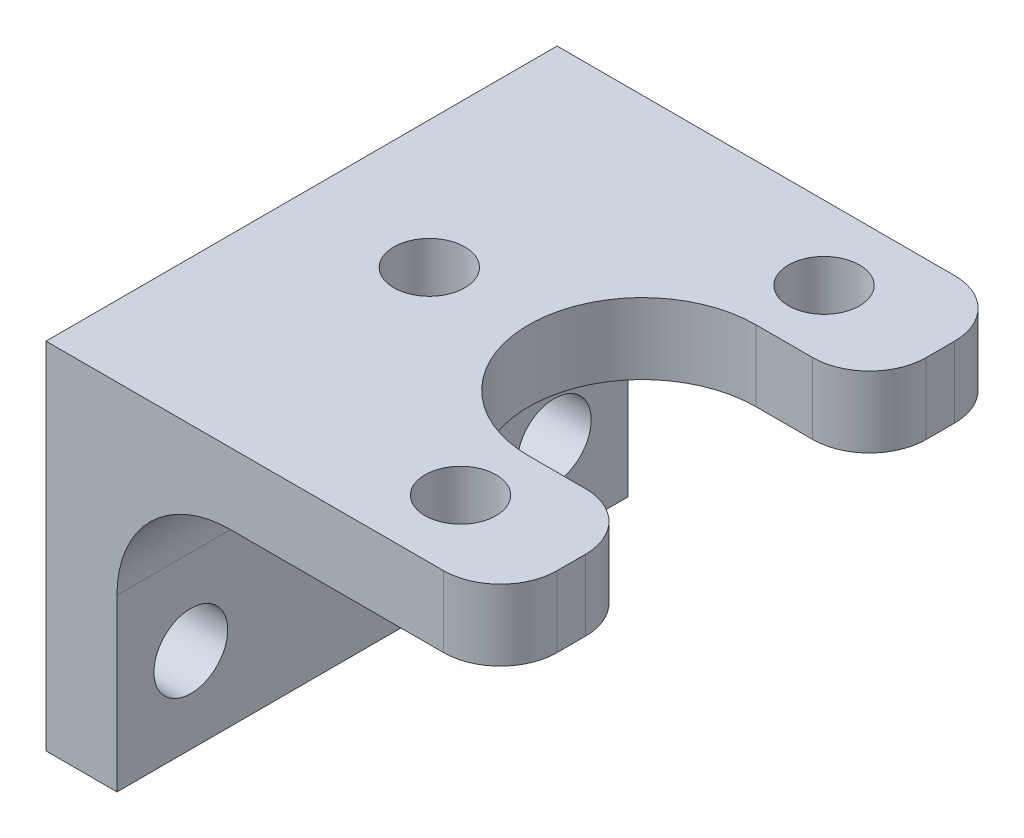
from build123d import *

# Parameters (mm, degrees)
SKETCH1_W           = 20.32
SKETCH1_H           = 22.86
BOSS_EXTRUDE1_DEPTH = 3.175
FILLET1_R           = 2.54
FILLET2_R           = 2.54
CUT_EXTRUDE2_DEPTH  = 16.618934823
FILLET3_R           = 2.54
FILLET4_R           = 2.54
SKETCH4_W           = 3.175
SKETCH4_H           = 22.86
BOSS_EXTRUDE2_DEPTH = 12.7
FILLET6_R           = 5.08
SKETCH3_R           = 1.5875
CUT_EXTRUDE3_DEPTH  = 6.35
SKETCH5_R           = 11.43
CUT_EXTRUDE4_DEPTH  = 5.08
SKETCH6_R           = 1.651
CUT_EXTRUDE5_DEPTH  = 25.205080609


with BuildPart() as part:
    # Sketch1 → Boss-Extrude1 (new body)
    with BuildSketch(Plane(origin=(0, 0, 0), x_dir=(1, 0, 0), z_dir=(0, 1, 0))):
        Rectangle(SKETCH1_W, SKETCH1_H)
    extrude(amount=BOSS_EXTRUDE1_DEPTH)

    # Fillet1
    fillet1_edges = [part.edges().sort_by_distance(p)[0] for p in [
        (10.16, 1.5875, -11.43),
    ]]
    fillet(fillet1_edges, radius=FILLET1_R)

    # Fillet2
    fillet2_edges = [part.edges().sort_by_distance(p)[0] for p in [
        (10.16, 1.5875, 11.43),
    ]]
    fillet(fillet2_edges, radius=FILLET2_R)

    # Sketch2 → Cut-Extrude2 (cut, through all)
    with BuildSketch(Plane.XZ):
        with BuildLine():
            Line((5.08, -5.08), (10.16, -5.08))
            Line((10.16, -5.08), (10.16, 5.08))
            Line((10.16, 5.08), (5.08, 5.08))
            ThreePointArc((5.08, 5.08), (0, 0), (5.08, -5.08))
        make_face()
    extrude(amount=-CUT_EXTRUDE2_DEPTH, mode=Mode.SUBTRACT)

    # Fillet3
    fillet3_edges = [part.edges().sort_by_distance(p)[0] for p in [
        (10.16, 1.5875, 5.08),
    ]]
    fillet(fillet3_edges, radius=FILLET3_R)

    # Fillet4
    fillet4_edges = [part.edges().sort_by_distance(p)[0] for p in [
        (10.16, 1.5875, -5.08),
    ]]
    fillet(fillet4_edges, radius=FILLET4_R)

    # Sketch4 → Boss-Extrude2 (add)
    with BuildSketch(Plane.XZ):
        with Locations((-8.5725, 0)):
            Rectangle(SKETCH4_W, SKETCH4_H)
    extrude(amount=BOSS_EXTRUDE2_DEPTH)

    # Fillet6
    fillet6_edges = [part.edges().sort_by_distance(p)[0] for p in [
        (-6.985, 0, 0),
    ]]
    fillet(fillet6_edges, radius=FILLET6_R)

    # Sketch3 → Cut-Extrude3 (cut, symmetric)
    with BuildSketch(Plane.XZ):
        with Locations((5.08, 8.128)):
            Circle(SKETCH3_R)
        with Locations((5.08, -8.128)):
            Circle(SKETCH3_R)
        with Locations((-4.445, 0)):
            Circle(SKETCH3_R)
    extrude(amount=CUT_EXTRUDE3_DEPTH, both=True, mode=Mode.SUBTRACT)

    # Sketch5 → Cut-Extrude4 (cut)
    with BuildSketch(Plane.XZ):
        with Locations((5.08, 0)):
            Circle(SKETCH5_R)
    extrude(amount=CUT_EXTRUDE4_DEPTH, mode=Mode.SUBTRACT)

    # Sketch6 → Cut-Extrude5 (cut, through all)
    with BuildSketch(Plane(origin=(-6.985, 0, 0), x_dir=(0, 0, -1), z_dir=(1, 0, 0))):
        with Locations((-8.128, -8.89)):
            Circle(SKETCH6_R)
        with Locations((8.128, -8.89)):
            Circle(SKETCH6_R)
    extrude(amount=-CUT_EXTRUDE5_DEPTH, mode=Mode.SUBTRACT)


solid = part.part
